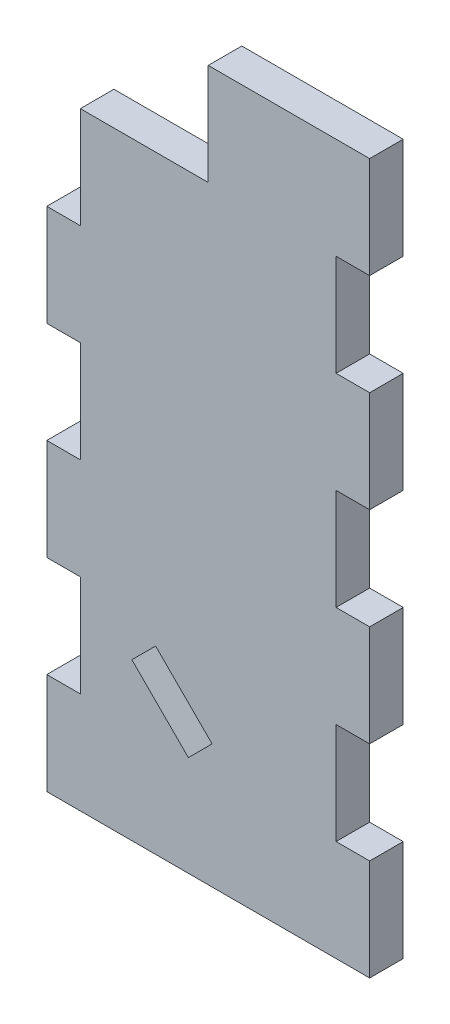
from build123d import *

# Parameters (mm, degrees)
SKETCH1_W           = 51.308
SKETCH1_H           = 112.776
BOSS_EXTRUDE1_DEPTH = 5.334
SKETCH2_W           = 5.334
SKETCH2_H           = 16.110857143
SKETCH2_H_2         = 16.110857142
CUT_EXTRUDE1_DEPTH  = 82.040197417
CUT_EXTRUDE2_DEPTH  = 82.040197417
SKETCH4_W           = 25.654
SKETCH4_H           = 16.110857143
CUT_EXTRUDE3_DEPTH  = 82.040197417


with BuildPart() as part:
    # Sketch1 → Boss-Extrude1 (new body)
    with BuildSketch(Plane.XY):
        with Locations((-14.268031982, -13.934780119)):
            Rectangle(SKETCH1_W, SKETCH1_H)
    extrude(amount=BOSS_EXTRUDE1_DEPTH)

    # Sketch2 → Cut-Extrude1 (cut, through all)
    with BuildSketch(Plane.XY.offset(5.334)):
        with Locations((-37.255031982, 18.286934167)):
            Rectangle(SKETCH2_W, SKETCH2_H)
        with Locations((-37.255031982, -13.93478012)):
            Rectangle(SKETCH2_W, SKETCH2_H)
        with Locations((-37.255031982, -46.156494405)):
            Rectangle(SKETCH2_W, SKETCH2_H_2)
        with Locations((8.718968018, -46.156494405)):
            Rectangle(SKETCH2_W, SKETCH2_H_2)
        with Locations((8.718968018, -13.93478012)):
            Rectangle(SKETCH2_W, SKETCH2_H)
        with Locations((8.718968018, 18.286934167)):
            Rectangle(SKETCH2_W, SKETCH2_H)
    extrude(amount=-CUT_EXTRUDE1_DEPTH, mode=Mode.SUBTRACT)

    # Sketch3 → Cut-Extrude2 (cut, through all)
    with BuildSketch(Plane.XY.offset(5.334)):
        Polygon((-22.630728797, -41.640083304), (-13.650472676, -50.620339425), (-17.422180247, -54.392046996), (-26.402436368, -45.411790875), align=None)
    extrude(amount=-CUT_EXTRUDE2_DEPTH, mode=Mode.SUBTRACT)

    # Sketch4 → Cut-Extrude3 (cut, through all)
    with BuildSketch(Plane.XY.offset(5.334)):
        with Locations((-27.095031982, 34.39779131)):
            Rectangle(SKETCH4_W, SKETCH4_H)
    extrude(amount=-CUT_EXTRUDE3_DEPTH, mode=Mode.SUBTRACT)


solid = part.part
